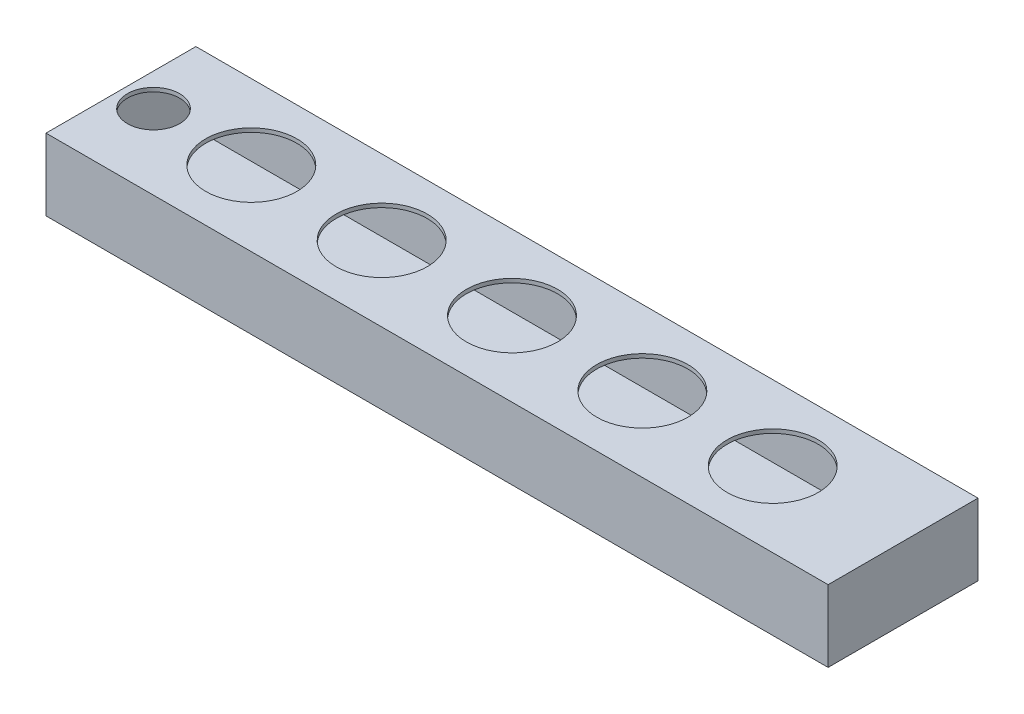
from build123d import *

# Parameters (mm, degrees)
SKETCH_2_W          = 600
SKETCH_2_H          = 55
EXTRUDE_1_DEPTH     = 115
SKETCH_3_W          = 109
SKETCH_3_H          = 49
CUT_EXTRUDE_1_DEPTH = 600
SKETCH_4_W          = 3
SKETCH_4_H          = 115
EXTRUDE_2_DEPTH     = 55
SKETCH_5_R          = 20
SKETCH_5_R_2        = 35
CUT_EXTRUDE_2_DEPTH = 3
SKETCH_6_R          = 20
CUT_EXTRUDE_3_DEPTH = 3


with BuildPart() as part:
    # Эскиз2 → Бобышка-Вытянуть1 (new body)
    with BuildSketch(Plane.XY):
        with Locations((300, 27.5)):
            Rectangle(SKETCH_2_W, SKETCH_2_H)
    extrude(amount=EXTRUDE_1_DEPTH)

    # Эскиз3 → Вырез-Вытянуть1 (cut)
    with BuildSketch(Plane(origin=(600, 0, 0), x_dir=(0, 0, -1), z_dir=(1, 0, 0))):
        with Locations((-57.5, 27.5)):
            Rectangle(SKETCH_3_W, SKETCH_3_H)
    extrude(amount=-CUT_EXTRUDE_1_DEPTH, mode=Mode.SUBTRACT)

    # Эскиз4 → Бобышка-Вытянуть2 (add)
    with BuildSketch(Plane(origin=(0, 55, 0), x_dir=(1, 0, 0), z_dir=(0, 1, 0))):
        with Locations((598.5, -57.5)):
            Rectangle(SKETCH_4_W, SKETCH_4_H)
        with Locations((1.5, -57.5)):
            Rectangle(SKETCH_4_W, SKETCH_4_H)
    extrude(amount=-EXTRUDE_2_DEPTH)

    # Эскиз5 → Вырез-Вытянуть2 (cut)
    with BuildSketch(Plane(origin=(0, 55, 0), x_dir=(1, 0, 0), z_dir=(0, 1, 0))):
        with Locations((25, -57.5)):
            Circle(SKETCH_5_R)
        with Locations((100, -57.5)):
            Circle(SKETCH_5_R_2)
        with Locations((200, -57.5)):
            Circle(SKETCH_5_R_2)
        with Locations((300, -57.5)):
            Circle(SKETCH_5_R_2)
        with Locations((400, -57.5)):
            Circle(SKETCH_5_R_2)
        with Locations((500, -57.5)):
            Circle(SKETCH_5_R_2)
    extrude(amount=-CUT_EXTRUDE_2_DEPTH, mode=Mode.SUBTRACT)

    # Эскиз6 → Вырез-Вытянуть3 (cut)
    with BuildSketch(Plane.XZ):
        with Locations((575, 57.5)):
            Circle(SKETCH_6_R)
    extrude(amount=-CUT_EXTRUDE_3_DEPTH, mode=Mode.SUBTRACT)


solid = part.part
